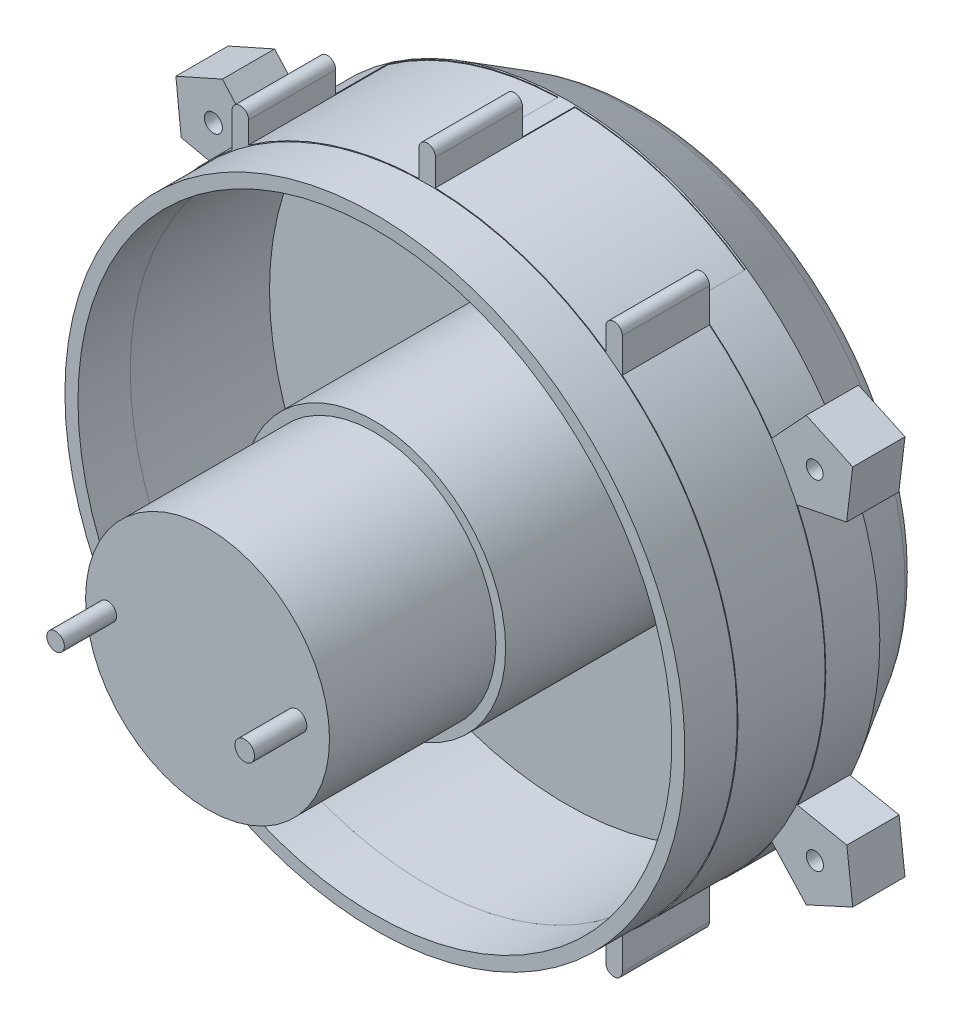
from build123d import *
from build123d.topology import SkipClean

# Parameters (mm, degrees)
SKETCH3_R                 = 43.308395252
BOSS_EXTRUDE1_DEPTH       = 12.7
SKETCH4_R                 = 45.197989656
SKETCH4_R_2               = 43.292989656
BOSS_EXTRUDE2_DEPTH       = 7.62
BOSS_EXTRUDE3_OUTLINE_R   = 1.251086703
BOSS_EXTRUDE3_OUTLINE_R_2 = 1.119854884
BOSS_EXTRUDE3_OUTLINE_R_3 = 1.226343403
BOSS_EXTRUDE3_OUTLINE_R_4 = 43.308395252
BOSS_EXTRUDE3_OUTLINE_R_5 = 1.312287122
BOSS_EXTRUDE3_DEPTH       = 7.62
SKETCH8_R                 = 45.413599663
SKETCH8_R_2               = 17.78
BOSS_EXTRUDE4_DEPTH       = 0.254
BOSS_EXTRUDE5_START       = 28.08351791
SKETCH11_R                = 19.2024
SKETCH11_R_2              = 17.78
BOSS_EXTRUDE5_DEPTH       = 28.08351791
SKETCH14_R                = 17.78
BOSS_EXTRUDE6_DEPTH       = 24.257
SKETCH15_R                = 1.28308703
SKETCH15_R_2              = 1.42714276
BOSS_EXTRUDE7_DEPTH       = 7.62


# Read off the part's stored shape, not the designer's step: Boss-Extrude3
with BuildPart() as part:
    # Sketch3 → Boss-Extrude1 (new body)
    with BuildSketch(Plane.XY):
        with BuildLine():
            Line((-26.035, 37.08774892), (-26.035, 40.255386447))
            ThreePointArc((-26.035, 40.255386447), (-27.2415, 41.461886447), (-28.448, 40.255386447))
            Line((-28.448, 40.255386447), (-28.448, 35.270861075))
            ThreePointArc((-28.448, 35.270861075), (-45.3136, 0), (-28.448, -35.270861075))
            Line((-28.448, -35.270861075), (-28.448, -40.084313616))
            ThreePointArc((-28.448, -40.084313616), (-27.2415, -41.290813616), (-26.035, -40.084313616))
            Line((-26.035, -40.084313616), (-26.035, -37.08774892))
            ThreePointArc((-26.035, -37.08774892), (-14.225855988, -43.022637836), (-1.2065, -45.297535283))
            Line((-1.2065, -45.297535283), (-1.2065, -49.1871))
            ThreePointArc((-1.2065, -49.1871), (0, -50.3936), (1.2065, -49.1871))
            Line((1.2065, -49.1871), (1.2065, -45.297535283))
            ThreePointArc((1.2065, -45.297535283), (14.225855988, -43.022637836), (26.035, -37.08774892))
            Line((26.035, -37.08774892), (26.035, -40.084313616))
            ThreePointArc((26.035, -40.084313616), (27.2415, -41.290813616), (28.448, -40.084313616))
            Line((28.448, -40.084313616), (28.448, -35.270861075))
            ThreePointArc((28.448, -35.270861075), (45.3136, 0), (28.448, 35.270861075))
            Line((28.448, 35.270861075), (28.448, 40.255386447))
            ThreePointArc((28.448, 40.255386447), (27.2415, 41.461886447), (26.035, 40.255386447))
            Line((26.035, 40.255386447), (26.035, 37.08774892))
            ThreePointArc((26.035, 37.08774892), (14.225855988, 43.022637836), (1.2065, 45.297535283))
            Line((1.2065, 45.297535283), (1.2065, 49.171035283))
            ThreePointArc((1.2065, 49.171035283), (0, 50.377535283), (-1.2065, 49.171035283))
            Line((-1.2065, 49.171035283), (-1.2065, 45.297535283))
            ThreePointArc((-1.2065, 45.297535283), (-14.225855988, 43.022637836), (-26.035, 37.08774892))
        make_face()
        Circle(SKETCH3_R, mode=Mode.SUBTRACT)
    extrude(amount=BOSS_EXTRUDE1_DEPTH)

    # Sketch4 → Boss-Extrude2 (add)
    with BuildSketch(Plane.XY.offset(12.7)):
        with Locations(Location((0, 0, 0), (0, 0, 180))):
            Circle(SKETCH4_R)
        with Locations(Location((0, 0, 0), (0, 0, 180))):
            Circle(SKETCH4_R_2, mode=Mode.SUBTRACT)
    extrude(amount=BOSS_EXTRUDE2_DEPTH)

    # Boss-Extrude3 outline → Boss-Extrude3 (add)
    with BuildSketch(Plane(origin=(0, 0, 0), x_dir=(-1, 0, 0), z_dir=(0, 0, -1))):
        with BuildLine():
            Line((1.2065, -45.397570332), (1.2065, -45.297535283))
            ThreePointArc((1.2065, -45.297535283), (14.225855988, -43.022637836), (26.035, -37.08774892))
            Line((26.035, -37.08774892), (26.035, -37.209861721))
            ThreePointArc((26.035, -37.209861721), (32.348813344, -31.873959741), (37.590770255, -25.481935287))
            Line((37.590770255, -25.481935287), (42.563913297, -30.887993729))
            Line((42.563913297, -30.887993729), (49.335575426, -27.786028599))
            Line((49.335575426, -27.786028599), (48.477989954, -20.387235264))
            Line((48.477989954, -20.387235264), (41.277031293, -18.936782249))
            ThreePointArc((41.277031293, -18.936782249), (45.413584137, -0.037551817), (41.308291914, 18.868493674))
            Line((41.308291914, 18.868493674), (48.561417854, 20.411179708))
            Line((48.561417854, 20.411179708), (49.335575426, 27.786028599))
            Line((49.335575426, 27.786028599), (42.560905178, 30.801249841))
            Line((42.560905178, 30.801249841), (37.668742456, 25.366530628))
            ThreePointArc((37.668742456, 25.366530628), (32.397651513, 31.824317915), (26.035, 37.209861721))
            Line((26.035, 37.209861721), (26.035, 37.08774892))
            ThreePointArc((26.035, 37.08774892), (14.225855988, 43.022637836), (1.2065, 45.297535283))
            Line((1.2065, 45.297535283), (1.2065, 45.397570332))
            ThreePointArc((1.2065, 45.397570332), (0, 45.413599663), (-1.2065, 45.397570332))
            Line((-1.2065, 45.397570332), (-1.2065, 45.297535283))
            ThreePointArc((-1.2065, 45.297535283), (-14.225855988, 43.022637836), (-26.035, 37.08774892))
            Line((-26.035, 37.08774892), (-26.035, 37.209861721))
            ThreePointArc((-26.035, 37.209861721), (-32.32901523, 31.89404033), (-37.55909567, 25.528598997))
            Line((-37.55909567, 25.528598997), (-42.565054803, 30.923118495))
            Line((-42.565054803, 30.923118495), (-49.335575426, 27.786028599))
            Line((-49.335575426, 27.786028599), (-48.444231571, 20.377466752))
            Line((-48.444231571, 20.377466752), (-41.264653189, 18.963739915))
            ThreePointArc((-41.264653189, 18.963739915), (-45.413597241, 0.014831834), (-41.277031293, -18.936782249))
            Line((-41.277031293, -18.936782249), (-48.477989954, -20.387235264))
            Line((-48.477989954, -20.387235264), (-49.335575426, -27.786028599))
            Line((-49.335575426, -27.786028599), (-42.563913297, -30.887993729))
            Line((-42.563913297, -30.887993729), (-37.590770255, -25.481935287))
            ThreePointArc((-37.590770255, -25.481935287), (-32.348813344, -31.873959741), (-26.035, -37.209861721))
            Line((-26.035, -37.209861721), (-26.035, -37.08774892))
            ThreePointArc((-26.035, -37.08774892), (-14.225855988, -43.022637836), (-1.2065, -45.297535283))
            Line((-1.2065, -45.297535283), (-1.2065, -45.397570332))
            ThreePointArc((-1.2065, -45.397570332), (0, -45.413599663), (1.2065, -45.397570332))
        make_face()
        with Locations((-43.815, -24.676814501)):
            Circle(BOSS_EXTRUDE3_OUTLINE_R, mode=Mode.SUBTRACT)
        with Locations((43.815, -24.676814501)):
            Circle(BOSS_EXTRUDE3_OUTLINE_R_2, mode=Mode.SUBTRACT)
        with Locations((-43.791398207, 24.695162459)):
            Circle(BOSS_EXTRUDE3_OUTLINE_R_3, mode=Mode.SUBTRACT)
        Circle(BOSS_EXTRUDE3_OUTLINE_R_4, mode=Mode.SUBTRACT)
        with Locations((43.8731923, 24.631372396)):
            Circle(BOSS_EXTRUDE3_OUTLINE_R_5, mode=Mode.SUBTRACT)
    extrude(amount=BOSS_EXTRUDE3_DEPTH)

    # Sketch8 → Boss-Extrude4 (add)
    with BuildSketch(Plane(origin=(0, 0, -7.62), x_dir=(-1, 0, 0), z_dir=(0, 0, -1))):
        with Locations(Location((0, 0, 0), (0, 0, 204.644373174))):
            Circle(SKETCH8_R)
        Circle(SKETCH8_R_2, mode=Mode.SUBTRACT)
    extrude(amount=BOSS_EXTRUDE4_DEPTH)

    # Sketch11 → Boss-Extrude5 (add)
    with SkipClean():  # the faces are left unmerged after this step: merging them gives an invalid solid
        with BuildSketch(Plane.XY.offset(-7.62).offset(BOSS_EXTRUDE5_START)):
            with Locations(Location((0, 0, 0), (0, 0, 180))):
                Circle(SKETCH11_R)
            Circle(SKETCH11_R_2, mode=Mode.SUBTRACT)
        extrude(amount=-BOSS_EXTRUDE5_DEPTH)

    # Sketch13 → Revolve2 (revolve)
    with SkipClean():  # the faces are left unmerged after this step: merging them gives an invalid solid
        with BuildSketch(Plane(origin=(0, 0, 0), x_dir=(1, 0, 0), z_dir=(0, 1, 0)), mode=Mode.PRIVATE) as revolve2_sk:
            Polygon((-12.8016, 26.289), (-17.78, 25.67684141), (-12.8016, 25.67684141), align=None)
            with BuildLine():
                Line((-40.139149173, 16.823093253), (-45.413599663, 7.874))
                Line((-45.413599663, 7.874), (-43.162438604, 7.874))
                Line((-43.162438604, 7.874), (-37.250522269, 18.162169636))
                Line((-37.250522269, 18.162169636), (-17.78, 18.162169636))
                Line((-17.78, 18.162169636), (-17.78, 20.574))
                Line((-17.78, 20.574), (-17.78, 23.114))
                Line((-17.78, 23.114), (-17.78, 25.67684141))
                Line((-17.78, 25.67684141), (-17.78, 29.464))
                Line((-17.78, 29.464), (-19.197121901, 29.464))
                Line((-19.197121901, 29.464), (-19.197121901, 22.553338322))
                Line((-19.197121901, 22.553338322), (-27.444506964, 20.839604351))
                ThreePointArc((-27.444506964, 20.839604351), (-28.729577969, 20.640575588), (-30.028264855, 20.574))
                Line((-30.028264855, 20.574), (-33.574507721, 20.574))
                ThreePointArc((-33.574507721, 20.574), (-37.35484563, 19.570150338), (-40.139149173, 16.823093253))
            make_face()
        revolve(revolve2_sk.sketch.rotate(Axis((0, 0, 0), (0, 0, -1)), 180), axis=Axis((0, 0, 0), (0, 0, -1)))
    add(part.part.scale(1), mode=Mode.REPLACE)  # the faces are merged on a copy


with BuildPart() as revolve2_piece_1:
    # of the separate pieces the step leaves, piece 1, a body of its own (revolve2_pieces)
    add(part.part.solids().sort_by_distance((-26.035, -40.084313616, 0))[0])


with BuildPart() as revolve2_piece_2:
    # of the separate pieces the step leaves, piece 2, a body of its own (revolve2_pieces)
    add(part.part.solids().sort_by_distance((12.8016, 0, -26.289))[0])


with BuildPart() as body_3:
    # Sketch14 → Boss-Extrude6 (new body)
    with BuildSketch(Plane.XY.offset(20.46351791)):
        Circle(SKETCH14_R)
    extrude(amount=BOSS_EXTRUDE6_DEPTH)

    # Sketch15 → Boss-Extrude7 (add)
    with BuildSketch(Plane.XY.offset(44.72051791)):
        with Locations(Location((-14.541653004, 0, 0), (0, 0, 180))):
            Circle(SKETCH15_R)
        with Locations(Location((13.044718136, 0, 0), (0, 0, 180))):
            Circle(SKETCH15_R_2)
    extrude(amount=BOSS_EXTRUDE7_DEPTH)


solid = Compound([revolve2_piece_1.part, revolve2_piece_2.part, body_3.part])
